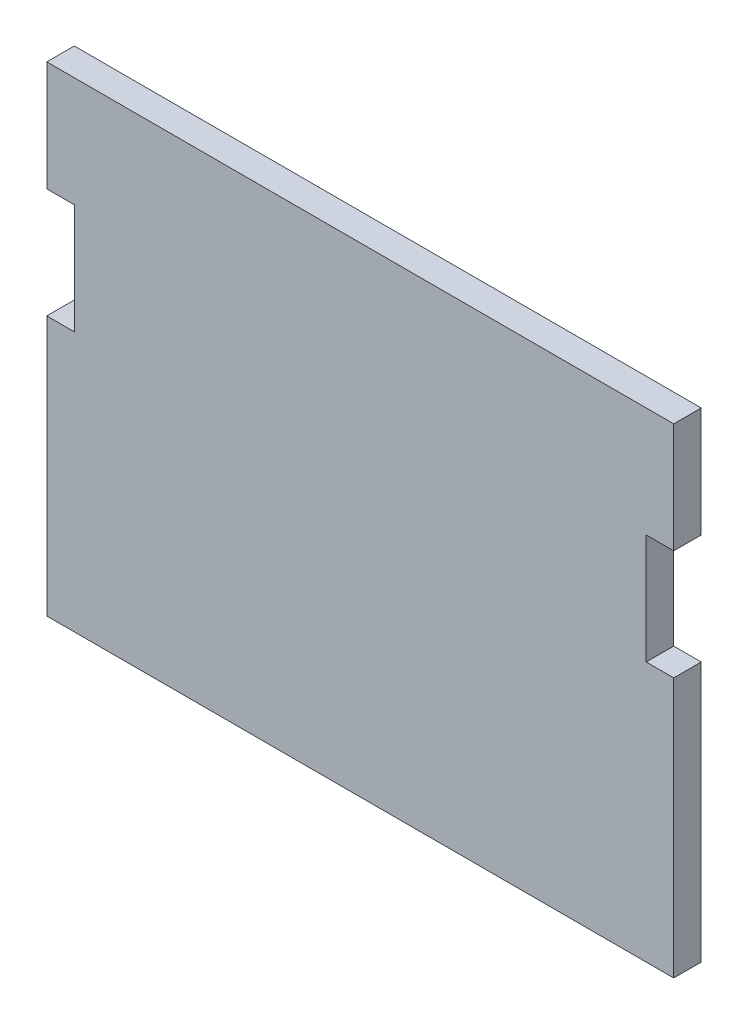
from build123d import *

# Parameters (mm, degrees)
SKETCH1_W           = 144.78
SKETCH1_H           = 114.3
BOSS_EXTRUDE1_DEPTH = 6.35
CAVITY1_START       = -72.39
CAVITY1_OUTLINE_W   = 25.4
CAVITY1_OUTLINE_H   = 6.35
CAVITY1_DEPTH       = 6.35
CAVITY1_START_2     = 66.04
CAVITY1_2_OUTLINE_W = 25.4
CAVITY1_2_OUTLINE_H = 6.35
CAVITY1_2_DEPTH     = 6.35
SKETCH4_W           = 144.78
SKETCH4_H           = 3.477037696
CUT_EXTRUDE2_DEPTH  = 93.448672787


# Read off the part's stored shape, not the designer's step: Cavity1
with BuildPart() as part:
    # Sketch1 → Boss-Extrude1 (new body)
    with BuildSketch(Plane.XY):
        Rectangle(SKETCH1_W, SKETCH1_H)
    extrude(amount=BOSS_EXTRUDE1_DEPTH)

    # Cavity1 outline → Cavity1 (cut)
    with BuildSketch(Plane.YZ.offset(CAVITY1_START)):
        with Locations((19.05, 3.175)):
            Rectangle(CAVITY1_OUTLINE_W, CAVITY1_OUTLINE_H)
    extrude(amount=CAVITY1_DEPTH, mode=Mode.SUBTRACT)

    # Cavity1 2 outline → Cavity1 2 (cut)
    with BuildSketch(Plane.YZ.offset(CAVITY1_START_2)):
        with Locations((19.05, 3.175)):
            Rectangle(CAVITY1_2_OUTLINE_W, CAVITY1_2_OUTLINE_H)
    extrude(amount=CAVITY1_2_DEPTH, mode=Mode.SUBTRACT)

    # Sketch4 → Cut-Extrude2 (cut, through all)
    with BuildSketch(Plane.XY.offset(6.35)):
        with Locations((0, -55.411481152)):
            Rectangle(SKETCH4_W, SKETCH4_H)
    extrude(amount=-CUT_EXTRUDE2_DEPTH, mode=Mode.SUBTRACT)


solid = part.part
